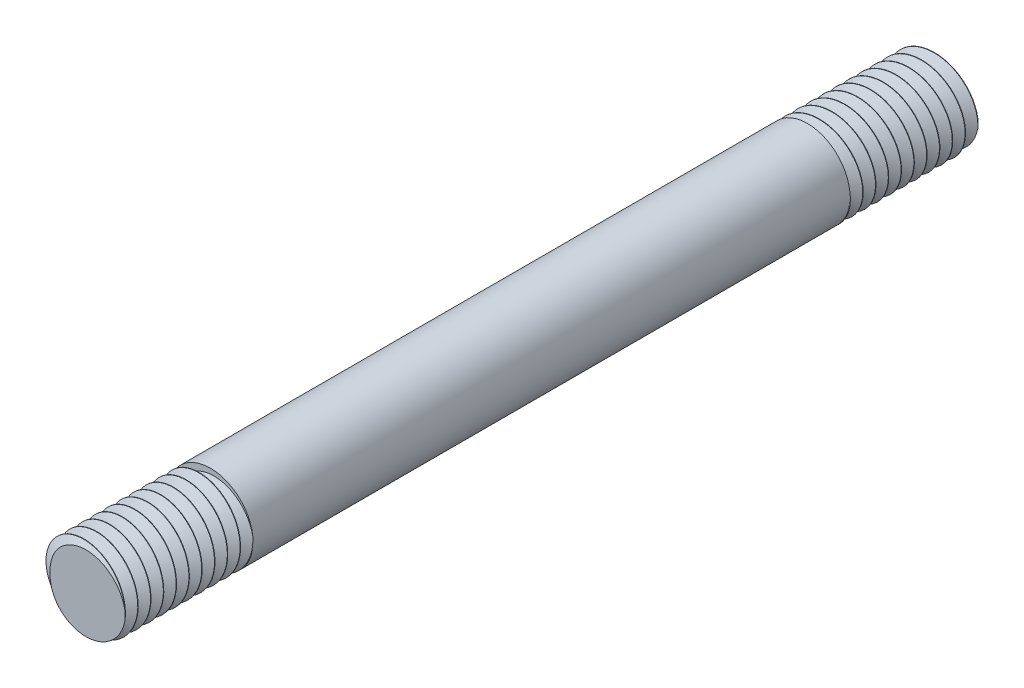
from build123d import *

# Parameters (mm, degrees)
CROQUIS1_R              = 5
SALIENTE_EXTRUIR1_DEPTH = 15
CORTAR_BARRER1_PITCH    = 1.5
CROQUIS4_R              = 5
SALIENTE_EXTRUIR2_DEPTH = 35


with BuildPart() as part:
    # Croquis1 → Saliente-Extruir1 (new body)
    with BuildSketch(Plane.XY):
        Circle(CROQUIS1_R)
    extrude(amount=SALIENTE_EXTRUIR1_DEPTH)

    # Cortar-Barrer1: arcs per turn and ends read off the stored shape
    # Cortar-Barrer1: the profile of Croquis3 profile screwed along a right-hand helix through 13.25 turns, 8 arcs to a turn; built about Z, then put on its axis
    cortar_barrer1_z = Axis((0, 0, 0), (0, 0, 1))
    cortar_barrer1_corners = [(5.0003, 0, -0.774826795), (5.0003, 0, -2.225173205), (3.874763165, 0, -1.57534421), (3.831263165, 0, -1.5), (3.874763165, 0, -1.42465579)]
    with BuildLine(mode=Mode.PRIVATE) as cortar_barrer1_profile:
        Line(cortar_barrer1_corners[0], cortar_barrer1_corners[1])
        Line(cortar_barrer1_corners[1], cortar_barrer1_corners[2])
        Line(cortar_barrer1_corners[4], cortar_barrer1_corners[0])
        ThreePointArc((3.874763165, 0, -1.57534421), (3.842918954, 0, -1.5435), (3.831263165, 0, -1.5))
        ThreePointArc((3.831263165, 0, -1.5), (3.842918954, 0, -1.4565), (3.874763165, 0, -1.42465579))
    cortar_barrer1_cap = Face(cortar_barrer1_profile.wire())
    cortar_barrer1_arcs = [((3.874763165, 0, -1.57534421), (3.831263165, 0, -1.550229473), (3.831263165, 0, -1.5), (1, 0.8660254037844373, 1)), ((3.831263165, 0, -1.5), (3.831263165, 0, -1.449770527), (3.874763165, 0, -1.42465579), (1, 0.8660254037844373, 1))]  # start, shoulder, end, weights
    cortar_barrer1_turn_angles = [0, 22.5, 45, 67.5, 90, 112.5, 135, 157.5, 180, 202.5, 225, 247.5, 270, 292.5, 315, 337.5, 360]
    cortar_barrer1_turn_weights = [1, 0.9238795325112867, 1, 0.9238795325112867, 1, 0.9238795325112867, 1, 0.9238795325112867, 1, 0.9238795325112867, 1, 0.9238795325112867, 1, 0.9238795325112867, 1, 0.9238795325112867, 1]
    cortar_barrer1_turn_rails = [Edge.make_bspline([Vector(p[0], p[1], 0).rotate(cortar_barrer1_z, cortar_barrer1_turn_angles[k]) / cortar_barrer1_turn_weights[k] + Vector(0, 0, p[2] + CORTAR_BARRER1_PITCH * cortar_barrer1_turn_angles[k] / 360) for k in range(17)], [0, 0, 0, 1, 1, 2, 2, 3, 3, 4, 4, 5, 5, 6, 6, 7, 7, 8, 8, 8], 2, cortar_barrer1_turn_weights) for p in cortar_barrer1_corners]
    cortar_barrer1_turn_sides = [*[Face.make_surface_from_curves(cortar_barrer1_turn_rails[p[0]], cortar_barrer1_turn_rails[p[1]]) for p in [(0, 1), (1, 2), (4, 0)]], *[Face.make_bezier_surface([[Vector(p[j][0], p[j][1], 0).rotate(cortar_barrer1_z, cortar_barrer1_turn_angles[2 * i + k]) / cortar_barrer1_turn_weights[2 * i + k] + Vector(0, 0, p[j][2] + CORTAR_BARRER1_PITCH * cortar_barrer1_turn_angles[2 * i + k] / 360) for k in range(3)] for j in range(3)], [[p[3][j] * cortar_barrer1_turn_weights[2 * i + k] for k in range(3)] for j in range(3)]) for p in cortar_barrer1_arcs for i in range(8)]]
    cortar_barrer1_last_angles = [4680, 4702.5, 4725, 4747.5, 4770]
    cortar_barrer1_last_weights = [1, 0.9238795325112867, 1, 0.9238795325112867, 1]
    cortar_barrer1_last_rails = [Edge.make_bspline([Vector(p[0], p[1], 0).rotate(cortar_barrer1_z, cortar_barrer1_last_angles[k]) / cortar_barrer1_last_weights[k] + Vector(0, 0, p[2] + CORTAR_BARRER1_PITCH * cortar_barrer1_last_angles[k] / 360) for k in range(5)], [0, 0, 0, 1, 1, 2, 2, 2], 2, cortar_barrer1_last_weights) for p in cortar_barrer1_corners]
    cortar_barrer1_last_sides = [*[Face.make_surface_from_curves(cortar_barrer1_last_rails[p[0]], cortar_barrer1_last_rails[p[1]]) for p in [(0, 1), (1, 2), (4, 0)]], *[Face.make_bezier_surface([[Vector(p[j][0], p[j][1], 0).rotate(cortar_barrer1_z, cortar_barrer1_last_angles[2 * i + k]) / cortar_barrer1_last_weights[2 * i + k] + Vector(0, 0, p[j][2] + CORTAR_BARRER1_PITCH * cortar_barrer1_last_angles[2 * i + k] / 360) for k in range(3)] for j in range(3)], [[p[3][j] * cortar_barrer1_last_weights[2 * i + k] for k in range(3)] for j in range(3)]) for p in cortar_barrer1_arcs for i in range(2)]]
    cortar_barrer1 = Plane(origin=(0, 0, 0), x_dir=(-1, 0, 0), z_dir=(0, 0, 1)) * Solid(Shell([*[p.moved(Location((0, 0, CORTAR_BARRER1_PITCH * i))) for i in range(13) for p in cortar_barrer1_turn_sides], *cortar_barrer1_last_sides, cortar_barrer1_cap, cortar_barrer1_cap.rotate(cortar_barrer1_z, 4770).moved(Location((0, 0, CORTAR_BARRER1_PITCH * 4770 / 360)))]))
    add(cortar_barrer1, mode=Mode.SUBTRACT)

    # Croquis4 → Saliente-Extruir2 (add)
    with BuildSketch(Plane.XY.offset(15)):
        with Locations(Location((0, 0, 0), (0, 0, 6.20192169))):
            Circle(CROQUIS4_R)
    extrude(amount=SALIENTE_EXTRUIR2_DEPTH)

    # Simetría2: part across plane


with BuildPart() as part_1:
    add(part.part)
    add(part.part.mirror(Plane.XY.offset(50)))


solid = part_1.part
